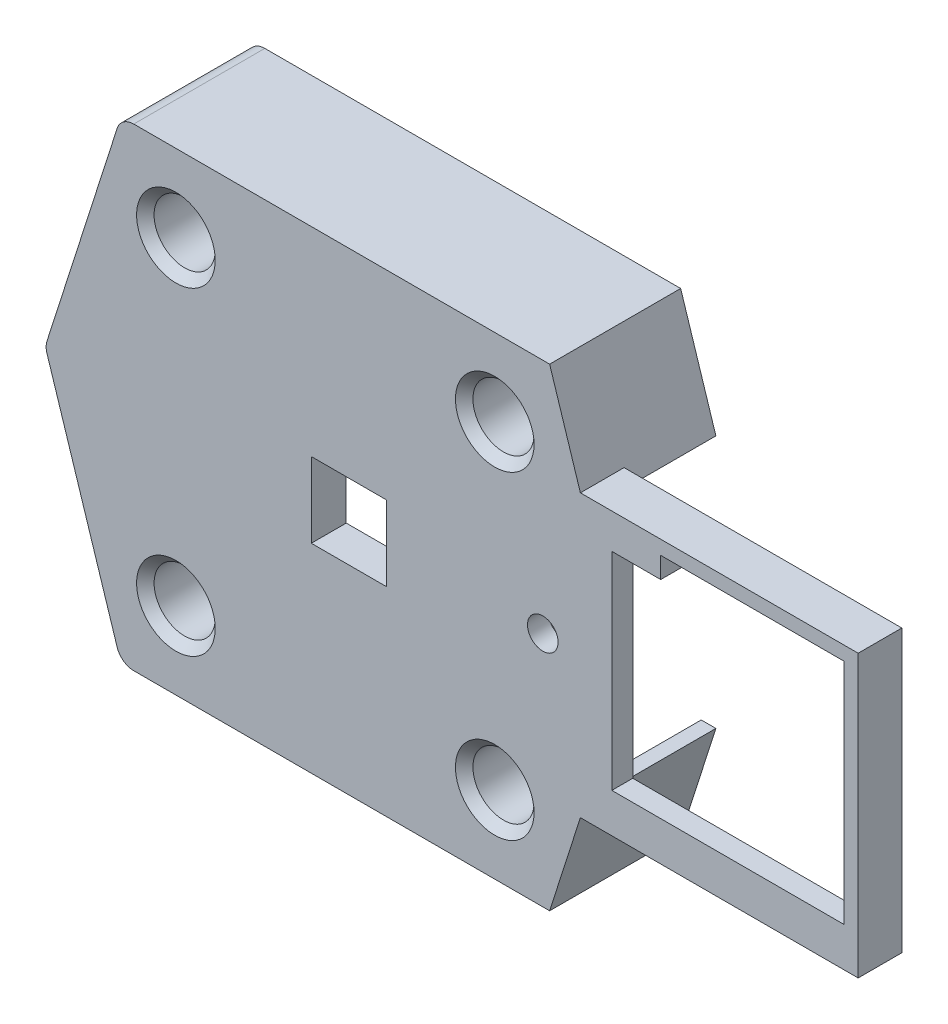
from build123d import *

# Parameters (mm, degrees)
BOSS_EXTRUDE1_DEPTH      = 10
BOSS_EXTRUDE1_DEPTH_BACK = 5
BOSS_EXTRUDE2_DEPTH      = 5
CUT_EXTRUDE1_DEPTH       = 68.390151358
BOSS_EXTRUDE3_DEPTH      = 4
SKETCH7_R                = 1.75
BOSS_EXTRUDE4_DEPTH      = 2.4
SKETCH8_R                = 3.5
BOSS_EXTRUDE5_DEPTH      = 1
SKETCH9_R                = 5.1
SKETCH9_R_2              = 3.5
BOSS_EXTRUDE6_DEPTH      = 9
CHAMFER1_SIZE            = 1
FILLET1_R                = 2


with BuildPart() as part:
    # Sketch2 → Boss-Extrude1 (new, two sides: drawn at the far end of the back side and taken through both)
    with BuildSketch(Plane.XY.offset(12).offset(-BOSS_EXTRUDE1_DEPTH_BACK)):
        Polygon((-24.532899998, 27.1), (-33.204899998, 0), (-24.532899998, -27.1), (24.532899998, -27.1), (33.204899998, 0), (24.532899998, 27.1), align=None)
        Polygon((-23.36497619, 25.5), (-31.52497619, 0), (-23.36497619, -25.5), (23.36497619, -25.5), (31.52497619, 0), (23.36497619, 25.5), align=None, mode=Mode.SUBTRACT)
    extrude(amount=BOSS_EXTRUDE1_DEPTH + BOSS_EXTRUDE1_DEPTH_BACK)

    # Sketch3 → Boss-Extrude2 (add)
    with BuildSketch(Plane.XY.offset(22)):
        Polygon((29.75, 16.1), (59.85, 16.1), (59.85, -16.1), (29.75, -16.1), (28.052899998, -16.1), (28.564899998, -14.5), (29.75, -14.5), (58.25, -14.5), (58.25, 14.5), (29.75, 14.5), (28.564899998, 14.5), (28.052899998, 16.1), align=None)
    extrude(amount=-BOSS_EXTRUDE2_DEPTH)

    # Sketch4 → Cut-Extrude1 (cut, through all)
    with BuildSketch(Plane(origin=(0, 0, 7), x_dir=(-1, 0, 0), z_dir=(0, 0, -1))):
        Polygon((-26.88497619, 14.5), (-28.564899998, 14.5), (-33.204899998, 0), (-28.564899998, -14.5), (-26.88497619, -14.5), (-31.52497619, 0), align=None)
    extrude(amount=-CUT_EXTRUDE1_DEPTH, mode=Mode.SUBTRACT)

    # Sketch5 → Boss-Extrude3 (add)
    with BuildSketch(Plane.XY.offset(22)):
        Polygon((29.25, 4.3), (29.25, 14), (29.25, 14.5), (27.65, 14.5), (27.65, 14), (27.65, 5.9), (-4.35, 5.9), (-4.35, -5.9), (27.65, -5.9), (27.65, -14), (27.65, -14.5), (29.25, -14.5), (29.25, -14), (29.25, -4.3), (-2.75, -4.3), (-2.75, 4.3), align=None)
    extrude(amount=-BOSS_EXTRUDE3_DEPTH)

    # Sketch7 → Boss-Extrude4 (add)
    with BuildSketch(Plane.XY.offset(22)):
        Polygon((37.25, 12.1), (37.25, 14.5), (29.25, 14.5), (29.25, 4.3), (5.85, 4.3), (5.85, -4.3), (29.25, -4.3), (29.25, -14.5), (58.25, -14.5), (58.25, -11.6), (31.65, -11.6), (31.65, 12.1), align=None)
        with Locations((23.75, 0)):
            Circle(SKETCH7_R, mode=Mode.SUBTRACT)
    extrude(amount=-BOSS_EXTRUDE4_DEPTH)

    # Sketch8 → Boss-Extrude5 (add)
    with BuildSketch(Plane.XY.offset(22)):
        Polygon((27.65, -5.9), (27.65, -14.5), (26.88497619, -14.5), (23.36497619, -25.5), (-23.36497619, -25.5), (-31.52497619, 0), (-23.36497619, 25.5), (23.36497619, 25.5), (26.88497619, 14.5), (27.65, 14.5), (27.65, 5.9), (-4.35, 5.9), (-4.35, -5.9), align=None)
        with Locations((-18.25, 18.25)):
            Circle(SKETCH8_R, mode=Mode.SUBTRACT)
        with Locations((18.25, 18.25)):
            Circle(SKETCH8_R, mode=Mode.SUBTRACT)
        with Locations((18.25, -18.25)):
            Circle(SKETCH8_R, mode=Mode.SUBTRACT)
        with Locations((-18.25, -18.25)):
            Circle(SKETCH8_R, mode=Mode.SUBTRACT)
    extrude(amount=-BOSS_EXTRUDE5_DEPTH)

    # Sketch9 → Boss-Extrude6 (add)
    # profile 1 of 4: a face of its own
    with BuildSketch(Plane(origin=(0, 0, 21), x_dir=(-1, 0, 0), z_dir=(0, 0, -1))):
        with Locations(Location((-18.25, 18.25, 0), (0, 0, 180))):
            Circle(SKETCH9_R)
        with Locations(Location((-18.25, 18.25, 0), (0, 0, 180))):
            Circle(SKETCH9_R_2, mode=Mode.SUBTRACT)
    # profile 2 of 4: a face of its own
    with BuildSketch(Plane(origin=(0, 0, 21), x_dir=(-1, 0, 0), z_dir=(0, 0, -1))):
        with Locations(Location((18.25, 18.25, 0), (0, 0, 180))):
            Circle(SKETCH9_R)
        with Locations(Location((18.25, 18.25, 0), (0, 0, 180))):
            Circle(SKETCH9_R_2, mode=Mode.SUBTRACT)
    # profile 3 of 4: a face of its own
    with BuildSketch(Plane(origin=(0, 0, 21), x_dir=(-1, 0, 0), z_dir=(0, 0, -1))):
        with Locations(Location((18.25, -18.25, 0), (0, 0, 180))):
            Circle(SKETCH9_R)
        with Locations(Location((18.25, -18.25, 0), (0, 0, 180))):
            Circle(SKETCH9_R_2, mode=Mode.SUBTRACT)
    # profile 4 of 4: a face of its own
    with BuildSketch(Plane(origin=(0, 0, 21), x_dir=(-1, 0, 0), z_dir=(0, 0, -1))):
        with Locations(Location((-18.25, -18.25, 0), (0, 0, 180))):
            Circle(SKETCH9_R)
        with Locations(Location((-18.25, -18.25, 0), (0, 0, 180))):
            Circle(SKETCH9_R_2, mode=Mode.SUBTRACT)
    extrude(amount=BOSS_EXTRUDE6_DEPTH)

    # Chamfer1
    chamfer1_edges = [part.edges().sort_by_distance(p)[0] for p in [
        (-21.75, -18.25, 22),
        (14.75, -18.25, 22),
        (14.75, 18.25, 22),
        (-21.75, 18.25, 22),
    ]]
    chamfer(chamfer1_edges, length=CHAMFER1_SIZE - 0.0001)  # a hair under: the kernel refuses the full size

    # Fillet1
    fillet1_edges = [part.edges().sort_by_distance(p)[0] for p in [
        (-24.532899998, -27.1, 14.5),
        (-33.204899998, 0, 14.5),
        (-24.532899998, 27.1, 14.5),
    ]]
    fillet(fillet1_edges, radius=FILLET1_R)


solid = part.part
